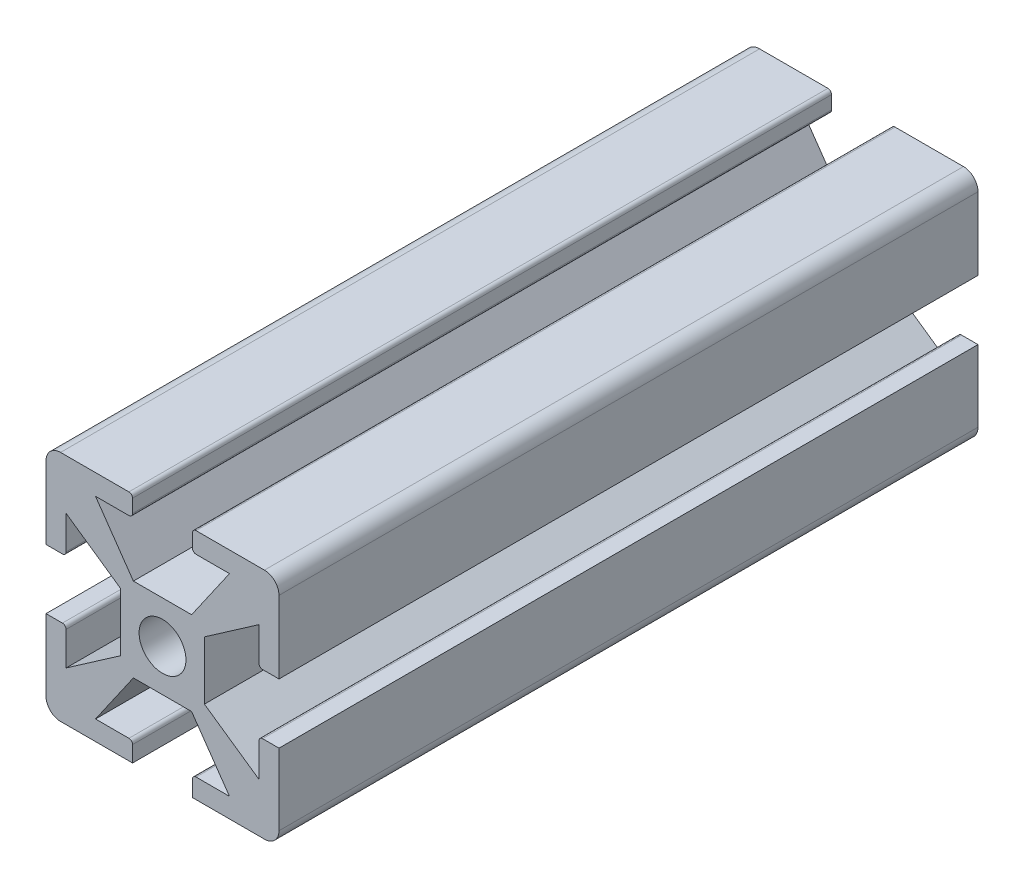
from build123d import *

# Parameters (mm, degrees)
SKETCH1_W           = 25.4
SKETCH1_H           = 25.4
BOSS_EXTRUDE1_DEPTH = 76.2
FILLET1_R           = 1.5875
HOLE1_OUTLINE_R     = 2.5527
HOLE1_DEPTH         = 76.2
SKETCH7_W           = 6.5278
SKETCH7_H           = 2.2352
CUT_EXTRUDE2_DEPTH  = 76.2
FILLET4_R           = 0.396875
CIRPATTERN2_DEPTH   = 76.2


# Read off the part's stored shape, not the designer's step: Hole1, CirPattern2
with BuildPart() as part:
    # Sketch1 → Boss-Extrude1 (new body)
    with BuildSketch(Plane.XY):
        Rectangle(SKETCH1_W, SKETCH1_H)
    extrude(amount=BOSS_EXTRUDE1_DEPTH)

    # Fillet1
    fillet1_edges = [part.edges().sort_by_distance(p)[0] for p in [
        (12.7, -12.7, 38.1),
        (-12.7, -12.7, 38.1),
        (-12.7, 12.7, 38.1),
        (12.7, 12.7, 38.1),
    ]]
    fillet(fillet1_edges, radius=FILLET1_R)

    # Hole1 outline → Hole1 (cut)
    with BuildSketch(Plane.XY):
        with Locations((0, -0.048792482)):
            Circle(HOLE1_OUTLINE_R)
    extrude(amount=HOLE1_DEPTH, mode=Mode.SUBTRACT)

    # Sketch7 → Cut-Extrude2 (cut)
    with BuildSketch(Plane.XY.offset(76.2)):
        with Locations((0, 11.5824)):
            Rectangle(SKETCH7_W, SKETCH7_H)
        Polygon((-3.175, 4.5212), (-7.3025, 10.4648), (7.3025, 10.4648), (3.175, 4.5212), align=None)
    extrude(amount=-CUT_EXTRUDE2_DEPTH, mode=Mode.SUBTRACT)

    # Fillet4
    fillet4_edges = [part.edges().sort_by_distance(p)[0] for p in [
        (-3.2639, 10.4648, 38.1),
        (-3.2639, 12.7, 38.1),
        (3.2639, 12.7, 38.1),
        (3.2639, 10.4648, 38.1),
    ]]
    fillet(fillet4_edges, radius=FILLET4_R)

    # CirPattern2 outline → CirPattern2 (cut)
    with BuildSketch(Plane.XY):
        with BuildLine():
            ThreePointArc((-3.660775, -10.562384964), (-3.380141996, -10.67862696), (-3.2639, -10.959259964))
            Line((-3.2639, -10.959259964), (-3.2639, -12.7))
            Line((-3.2639, -12.7), (3.2639, -12.7))
            Line((3.2639, -12.7), (3.2639, -10.959259964))
            ThreePointArc((3.2639, -10.959259964), (3.380141996, -10.67862696), (3.660775, -10.562384964))
            Line((3.660775, -10.562384964), (7.3025, -10.562384964))
            Line((7.3025, -10.562384964), (3.175, -4.618784964))
            Line((3.175, -4.618784964), (-3.175, -4.618784964))
            Line((-3.175, -4.618784964), (-7.3025, -10.562384964))
            Line((-7.3025, -10.562384964), (-3.660775, -10.562384964))
        make_face()
        with BuildLine():
            Line((-12.7, -3.312692482), (-10.910467482, -3.312692482))
            ThreePointArc((-10.910467482, -3.312692482), (-10.629834478, -3.428934478), (-10.513592482, -3.709567482))
            Line((-10.513592482, -3.709567482), (-10.513592482, -7.351292482))
            Line((-10.513592482, -7.351292482), (-4.569992482, -3.223792482))
            Line((-4.569992482, -3.223792482), (-4.569992482, 3.126207518))
            Line((-4.569992482, 3.126207518), (-10.513592482, 7.253707518))
            Line((-10.513592482, 7.253707518), (-10.513592482, 3.611982518))
            ThreePointArc((-10.513592482, 3.611982518), (-10.629834478, 3.331349514), (-10.910467482, 3.215107518))
            Line((-10.910467482, 3.215107518), (-12.7, 3.215107518))
            Line((-12.7, 3.215107518), (-12.7, -3.312692482))
        make_face()
        with BuildLine():
            ThreePointArc((10.513592482, -3.709567482), (10.629834478, -3.428934478), (10.910467482, -3.312692482))
            Line((10.910467482, -3.312692482), (12.7, -3.312692482))
            Line((12.7, -3.312692482), (12.7, 3.215107518))
            Line((12.7, 3.215107518), (10.910467482, 3.215107518))
            ThreePointArc((10.910467482, 3.215107518), (10.629834478, 3.331349514), (10.513592482, 3.611982518))
            Line((10.513592482, 3.611982518), (10.513592482, 7.253707518))
            Line((10.513592482, 7.253707518), (4.569992482, 3.126207518))
            Line((4.569992482, 3.126207518), (4.569992482, -3.223792482))
            Line((4.569992482, -3.223792482), (10.513592482, -7.351292482))
            Line((10.513592482, -7.351292482), (10.513592482, -3.709567482))
        make_face()
    extrude(amount=CIRPATTERN2_DEPTH, mode=Mode.SUBTRACT)


solid = part.part
